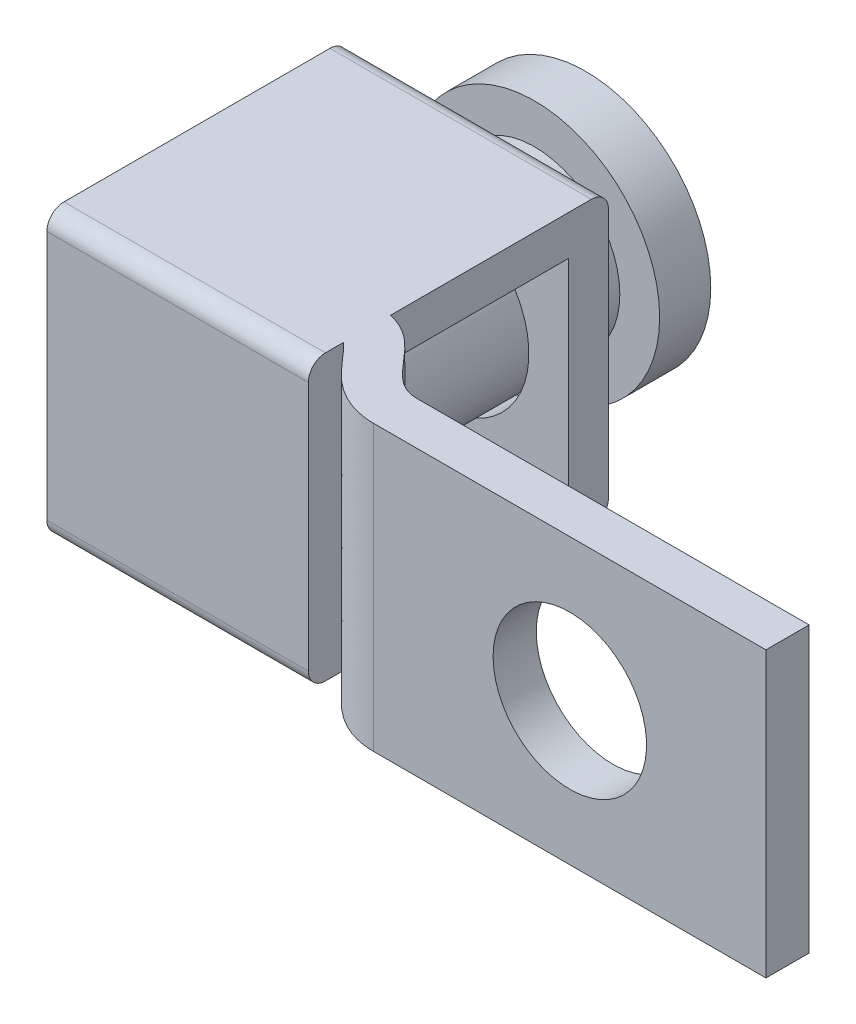
from build123d import *

# Parameters (mm, degrees)
EXTRUDE_THIN1_DEPTH = 12.7
SKETCH2_R           = 3.429
CUT_EXTRUDE1_DEPTH  = 2.54
SKETCH3_W           = 13.4112
SKETCH3_H           = 12.7
SKETCH3_W_2         = 9.8552
SKETCH3_H_2         = 9.144
BOSS_EXTRUDE1_DEPTH = 11.684
SKETCH4_R           = 4.064
CUT_EXTRUDE2_DEPTH  = 2.54
SKETCH5_W           = 3.81
SKETCH5_H           = 9.7028
CUT_EXTRUDE3_DEPTH  = 2.54
FILLET1_R           = 0.762


# Read off the part's stored shape, not the designer's step: Extrude-Thin1
with BuildPart() as part:
    # Extrude-Thin1 outline → Extrude-Thin1 (new body)
    with BuildSketch(Plane(origin=(0, 0, 0), x_dir=(1, 0, 0), z_dir=(0, 1, 0))):
        with BuildLine():
            Line((0, -1.9304), (17.526, -1.9304))
            Line((17.526, -1.9304), (17.526, 0))
            Line((17.526, 0), (0, 0))
            add(Edge.make_bspline(
                [(-4.064, 2.667), (-1.899902787, 2.408871589), (-1.602448269, 0), (0, 0)],
                knots=[0, 0, 0, 0, 1, 1, 1, 1], degree=3))
            Line((-4.064, 2.667), (-15.494, 2.667))
            Line((-15.494, 2.667), (-15.494, 0.7366))
            Line((-15.494, 0.7366), (-4.20884166, 0.7366))
            add(Edge.make_bspline(
                [(-4.20884166, 0.7366), (-4.133644752, 0.720873402), (-4.080917647, 0.701195252), (-3.96659915, 0.643669048), (-3.90467372, 0.60420831), (-3.753435107, 0.482014662), (-3.665236626, 0.399083494), (-3.463832261, 0.18557347), (-3.351169837, 0.05541551), (-3.094522195, -0.244365971), (-2.950821499, -0.414054001), (-2.606238329, -0.780981081), (-2.404944968, -0.97952681), (-1.897342594, -1.371030345), (-1.586807679, -1.564315851), (-1.033513097, -1.776746241), (-0.835509505, -1.833997779), (-0.424705159, -1.910866197), (-0.212243475, -1.9304), (0, -1.9304)],
                knots=[0, 0, 0, 0, 0.125, 0.125, 0.25, 0.25, 0.375, 0.375, 0.5, 0.5, 0.625, 0.625, 0.75, 0.75, 0.875, 0.875, 0.9375, 0.9375, 1, 1, 1, 1], degree=3))
        make_face()
    extrude(amount=EXTRUDE_THIN1_DEPTH)

    # Sketch2 → Cut-Extrude1 (cut)
    with BuildSketch(Plane(origin=(0, 0, 0), x_dir=(-1, 0, 0), z_dir=(0, 0, -1))):
        with Locations((-8.763, 6.35)):
            Circle(SKETCH2_R)
    extrude(amount=-CUT_EXTRUDE1_DEPTH, mode=Mode.SUBTRACT)

    # Sketch3 → Boss-Extrude1 (add)
    with BuildSketch(Plane.ZY.offset(15.494)):
        with Locations((-5.6642, 6.35)):
            Rectangle(SKETCH3_W, SKETCH3_H)
        with Locations((-5.6642, 6.35)):
            Rectangle(SKETCH3_W_2, SKETCH3_H_2, mode=Mode.SUBTRACT)
    extrude(amount=-BOSS_EXTRUDE1_DEPTH)

    # Sketch4 → Cut-Extrude2 (cut)
    with BuildSketch(Plane(origin=(0, 0, -12.3698), x_dir=(-1, 0, 0), z_dir=(0, 0, -1))):
        with Locations((9.652, 6.35)):
            Circle(SKETCH4_R)
    extrude(amount=-CUT_EXTRUDE2_DEPTH, mode=Mode.SUBTRACT)

    # Fillet1
    fillet1_edges = [part.edges().sort_by_distance(p)[0] for p in [
        (-9.652, 0, 1.0414),
        (-9.652, 12.7, 1.0414),
        (-9.652, 0, -12.3698),
        (-9.652, 12.7, -12.3698),
    ]]
    fillet(fillet1_edges, radius=FILLET1_R)


with BuildPart() as body_2:
    # Sketch5 → Revolve1 (revolve)
    with BuildSketch(Plane(origin=(0, 6.35, 0), x_dir=(-1, 0, 0), z_dir=(0, 1, 0)), mode=Mode.PRIVATE) as revolve1_sk:
        with BuildLine():
            Line((9.652, -18.4658), (9.652, -14.9098))
            Line((9.652, -14.9098), (13.462, -14.9098))
            Line((13.462, -14.9098), (15.24, -14.9098))
            Line((15.24, -14.9098), (15.24, -17.1958))
            ThreePointArc((15.24, -17.1958), (12.5172506, -18.144302639), (9.652, -18.4658))
        make_face()
        with Locations((11.557, -10.0584)):
            Rectangle(SKETCH5_W, SKETCH5_H)
    revolve(revolve1_sk.sketch.rotate(Axis((-9.652, 6.35, -10.803923228), (0, 0, -1)), 180), axis=Axis((-9.652, 6.35, -10.803923228), (0, 0, -1)))

    # Sketch6 → Cut-Extrude3 (cut)
    with BuildSketch(Plane.XY.offset(-17.1958)):
        Polygon((-6.022426526, 8.897003655), (-12.282712271, 2.780632525), (-13.281573474, 3.802996345), (-7.021287729, 9.919367475), align=None)
    extrude(amount=-CUT_EXTRUDE3_DEPTH, mode=Mode.SUBTRACT)


solid = Compound([part.part, body_2.part])
